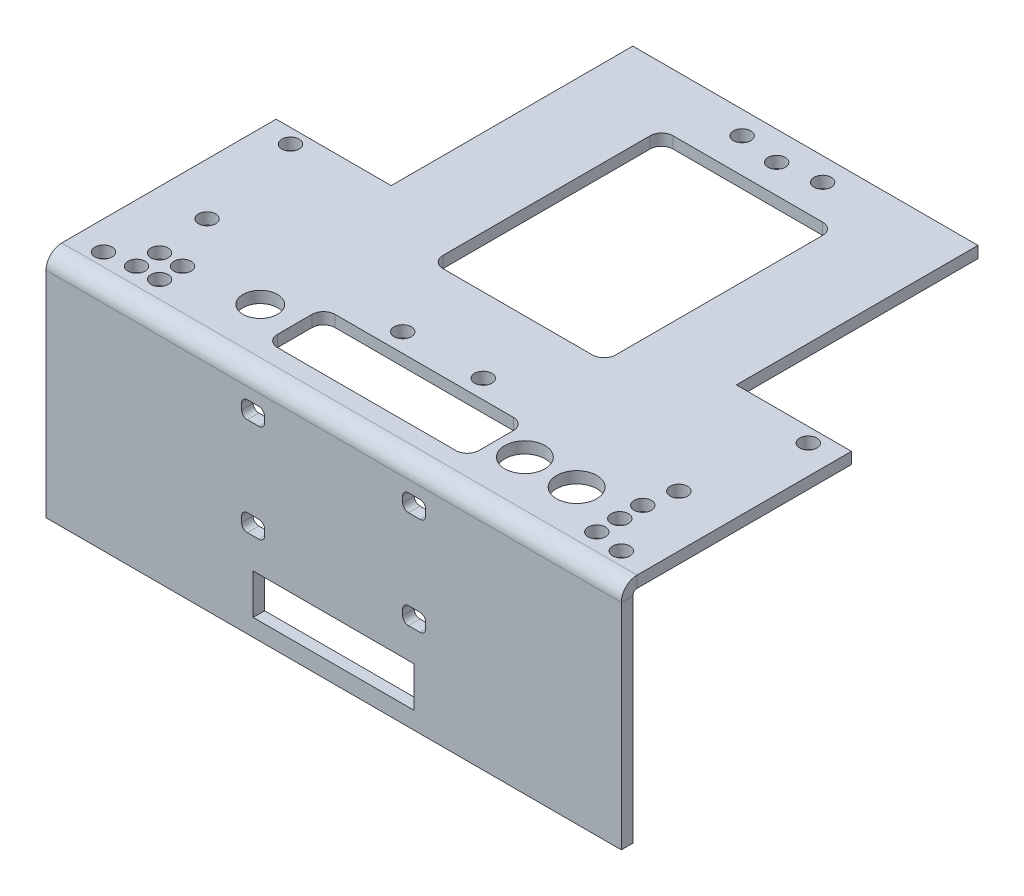
from build123d import *

# Parameters (mm, degrees)
SKETCH2_W                    = 100
SKETCH2_H                    = 85
BASE_FLANGE1_DEPTH           = 2
SKETCH15_R                   = 1.5
SKETCH15_W                   = 20
SKETCH15_H                   = 42
SKETCH15_W_2                 = 100
SKETCH15_H_2                 = 3
CUT_EXTRUDE2_DEPTH           = 10
EDGE_FLANGE3_STRIP_W         = 9.4732
EDGE_FLANGE3_STRIP_H         = 2
EDGE_FLANGE3_STRIP_CUT_DEPTH = 100
EDGE_FLANGE3_DEPTH           = 100
SKETCH23_W                   = 28
SKETCH23_H                   = 10
CUT_EXTRUDE3_DEPTH           = 10
SKETCH24_W                   = 28
SKETCH24_H                   = 3
TAB1_DEPTH                   = 2
SKETCH25_R                   = 1.5
CUT_EXTRUDE11_DEPTH          = 10
CUT_EXTRUDE7_DEPTH           = 10
CUT_EXTRUDE9_DEPTH           = 10
SKETCH34_R                   = 1.5
CUT_EXTRUDE10_DEPTH          = 10
SKETCH35_R                   = 3
SKETCH35_R_2                 = 3.5
CUT_EXTRUDE12_DEPTH          = 10


# Sheet-metal steps are written as plain solids
with BuildPart() as part:
    # Sketch2 → Base-Flange1 (new body)
    with BuildSketch(Plane(origin=(0, 0, 0), x_dir=(1, 0, 0), z_dir=(0, 1, 0))):
        with Locations((50, 42.5)):
            Rectangle(SKETCH2_W, SKETCH2_H)
    extrude(amount=-BASE_FLANGE1_DEPTH)

    # Sketch15 → Cut-Extrude2 (cut)
    with BuildSketch(Plane(origin=(0, 0, 0), x_dir=(1, 0, 0), z_dir=(0, 1, 0))):
        with Locations(Location((5, 8, 0), (0, 0, 270))):
            Circle(SKETCH15_R)
        with Locations(Location((5, 40.5, 0), (0, 0, 270))):
            Circle(SKETCH15_R)
        with Locations(Location((50, 80, 0), (0, 0, 270))):
            Circle(SKETCH15_R)
        with Locations(Location((95, 8, 0), (0, 0, 90))):
            Circle(SKETCH15_R)
        with Locations(Location((95, 40.5, 0), (0, 0, 90))):
            Circle(SKETCH15_R)
        with Locations((10, 64)):
            Rectangle(SKETCH15_W, SKETCH15_H)
        with Locations((90, 64)):
            Rectangle(SKETCH15_W, SKETCH15_H)
        with Locations((50, 1.5)):
            Rectangle(SKETCH15_W_2, SKETCH15_H_2)
    extrude(amount=-CUT_EXTRUDE2_DEPTH, mode=Mode.SUBTRACT)

    # Edge-Flange3 strip (across the edge) → Edge-Flange3 strip cut (cut)
    with BuildSketch(Plane(origin=(100, -2, -3), x_dir=(0, 0, -1), z_dir=(-1, 0, 0))):
        with Locations((-2, -1)):
            Rectangle(EDGE_FLANGE3_STRIP_W, EDGE_FLANGE3_STRIP_H)
    extrude(amount=EDGE_FLANGE3_STRIP_CUT_DEPTH, mode=Mode.SUBTRACT)

    # Edge-Flange3 section (across the edge) → Edge-Flange3 (add)
    with BuildSketch(Plane(origin=(100, -2, -3), x_dir=(0, 0, -1), z_dir=(-1, 0, 0))):
        with BuildLine():
            Line((0, 0.7366), (0, 38))
            Line((0, 38), (2, 38))
            Line((2, 38), (2, 0.7366))
            ThreePointArc((2, 0.7366), (2.215745145, 0.215745145), (2.7366, 0))
            Line((2.7366, 0), (2.7366, -2))
            ThreePointArc((2.7366, -2), (0.801531583, -1.198468417), (0, 0.7366))
        make_face()
    extrude(amount=EDGE_FLANGE3_DEPTH)

    # Sketch23 → Cut-Extrude3 (cut)
    with BuildSketch(Plane.XY.offset(-3)):
        with Locations((50, -35)):
            Rectangle(SKETCH23_W, SKETCH23_H)
    extrude(amount=-CUT_EXTRUDE3_DEPTH, mode=Mode.SUBTRACT)

    # Sketch24 → Tab1 (add)
    with BuildSketch(Plane.XY.offset(-3)):
        with Locations((50, -38.5)):
            Rectangle(SKETCH24_W, SKETCH24_H)
    extrude(amount=-TAB1_DEPTH)

    # Sketch25 → Cut-Extrude11 (cut)
    with BuildSketch(Plane(origin=(0, 0, 0), x_dir=(1, 0, 0), z_dir=(0, 1, 0))):
        with Locations(Location((43, 81, 0), (0, 0, 270))):
            Circle(SKETCH25_R)
        with Locations(Location((43, 22, 0), (0, 0, 270))):
            Circle(SKETCH25_R)
        with Locations(Location((9, 22, 0), (0, 0, 270))):
            Circle(SKETCH25_R)
        with Locations(Location((91, 22, 0), (0, 0, 90))):
            Circle(SKETCH25_R)
        with Locations(Location((57, 22, 0), (0, 0, 90))):
            Circle(SKETCH25_R)
        with Locations(Location((57, 81, 0), (0, 0, 90))):
            Circle(SKETCH25_R)
        with BuildLine():
            Line((37, 75), (63, 75))
            ThreePointArc((63, 75), (64.414213562, 74.414213562), (65, 73))
            Line((65, 73), (65, 37))
            ThreePointArc((65, 37), (64.414213562, 35.585786438), (63, 35))
            Line((63, 35), (37, 35))
            ThreePointArc((37, 35), (35.585786438, 35.585786438), (35, 37))
            Line((35, 37), (35, 73))
            ThreePointArc((35, 73), (35.585786438, 74.414213562), (37, 75))
        make_face()
    extrude(amount=-CUT_EXTRUDE11_DEPTH, mode=Mode.SUBTRACT)

    # Sketch28 → Cut-Extrude7 (cut)
    with BuildSketch(Plane(origin=(0, 0, 0), x_dir=(1, 0, 0), z_dir=(0, 1, 0))):
        with BuildLine():
            Line((34.5, 8.7366), (65.5, 8.7366))
            ThreePointArc((65.5, 8.7366), (66.914213562, 9.322386438), (67.5, 10.7366))
            Line((67.5, 10.7366), (67.5, 16.7366))
            ThreePointArc((67.5, 16.7366), (66.914213562, 18.150813562), (65.5, 18.7366))
            Line((65.5, 18.7366), (34.5, 18.7366))
            ThreePointArc((34.5, 18.7366), (33.085786438, 18.150813562), (32.5, 16.7366))
            Line((32.5, 16.7366), (32.5, 10.7366))
            ThreePointArc((32.5, 10.7366), (33.085786438, 9.322386438), (34.5, 8.7366))
        make_face()
    extrude(amount=-CUT_EXTRUDE7_DEPTH, mode=Mode.SUBTRACT)

    # Sketch33 → Cut-Extrude9 (cut)
    with BuildSketch(Plane.XY.offset(-3)):
        with BuildLine():
            Line((35, -4.7366), (37, -4.7366))
            ThreePointArc((37, -4.7366), (37.707106781, -5.029493219), (38, -5.7366))
            Line((38, -5.7366), (38, -6.7366))
            ThreePointArc((38, -6.7366), (37.707106781, -7.443706781), (37, -7.7366))
            Line((37, -7.7366), (35, -7.7366))
            ThreePointArc((35, -7.7366), (34.292893219, -7.443706781), (34, -6.7366))
            Line((34, -6.7366), (34, -5.7366))
            ThreePointArc((34, -5.7366), (34.292893219, -5.029493219), (35, -4.7366))
        make_face()
        with BuildLine():
            Line((35, -21.7366), (37, -21.7366))
            ThreePointArc((37, -21.7366), (37.707106781, -22.029493219), (38, -22.7366))
            Line((38, -22.7366), (38, -23.7366))
            ThreePointArc((38, -23.7366), (37.707106781, -24.443706781), (37, -24.7366))
            Line((37, -24.7366), (35, -24.7366))
            ThreePointArc((35, -24.7366), (34.292893219, -24.443706781), (34, -23.7366))
            Line((34, -23.7366), (34, -22.7366))
            ThreePointArc((34, -22.7366), (34.292893219, -22.029493219), (35, -21.7366))
        make_face()
        with BuildLine():
            Line((65, -24.7366), (63, -24.7366))
            ThreePointArc((63, -24.7366), (62.292893219, -24.443706781), (62, -23.7366))
            Line((62, -23.7366), (62, -22.7366))
            ThreePointArc((62, -22.7366), (62.292893219, -22.029493219), (63, -21.7366))
            Line((63, -21.7366), (65, -21.7366))
            ThreePointArc((65, -21.7366), (65.707106781, -22.029493219), (66, -22.7366))
            Line((66, -22.7366), (66, -23.7366))
            ThreePointArc((66, -23.7366), (65.707106781, -24.443706781), (65, -24.7366))
        make_face()
        with BuildLine():
            Line((65, -7.7366), (63, -7.7366))
            ThreePointArc((63, -7.7366), (62.292893219, -7.443706781), (62, -6.7366))
            Line((62, -6.7366), (62, -5.7366))
            ThreePointArc((62, -5.7366), (62.292893219, -5.029493219), (63, -4.7366))
            Line((63, -4.7366), (65, -4.7366))
            ThreePointArc((65, -4.7366), (65.707106781, -5.029493219), (66, -5.7366))
            Line((66, -5.7366), (66, -6.7366))
            ThreePointArc((66, -6.7366), (65.707106781, -7.443706781), (65, -7.7366))
        make_face()
    extrude(amount=-CUT_EXTRUDE9_DEPTH, mode=Mode.SUBTRACT)

    # Sketch34 → Cut-Extrude10 (cut)
    with BuildSketch(Plane(origin=(0, 0, 0), x_dir=(1, 0, 0), z_dir=(0, 1, 0))):
        with Locations(Location((10, 8.7366, 0), (0, 0, 270))):
            Circle(SKETCH34_R)
        with Locations(Location((90, 8.7366, 0), (0, 0, 270))):
            Circle(SKETCH34_R)
        with Locations(Location((14, 8.7366, 0), (0, 0, 270))):
            Circle(SKETCH34_R)
        with Locations(Location((14, 12.7366, 0), (0, 0, 270))):
            Circle(SKETCH34_R)
        with Locations(Location((10, 12.7366, 0), (0, 0, 270))):
            Circle(SKETCH34_R)
        with Locations(Location((90, 12.7366, 0), (0, 0, 270))):
            Circle(SKETCH34_R)
        with Locations(Location((90, 16.7366, 0), (0, 0, 270))):
            Circle(SKETCH34_R)
    extrude(amount=-CUT_EXTRUDE10_DEPTH, mode=Mode.SUBTRACT)

    # Sketch35 → Cut-Extrude12 (cut)
    with BuildSketch(Plane(origin=(0, 0, 0), x_dir=(1, 0, 0), z_dir=(0, 1, 0))):
        with Locations(Location((26.5, 13.7366, 0), (0, 0, 270))):
            Circle(SKETCH35_R)
        with Locations(Location((72.5, 13.7366, 0), (0, 0, 270))):
            Circle(SKETCH35_R_2)
        with Locations(Location((81.5, 13.7366, 0), (0, 0, 270))):
            Circle(SKETCH35_R_2)
    extrude(amount=-CUT_EXTRUDE12_DEPTH, mode=Mode.SUBTRACT)


solid = part.part
